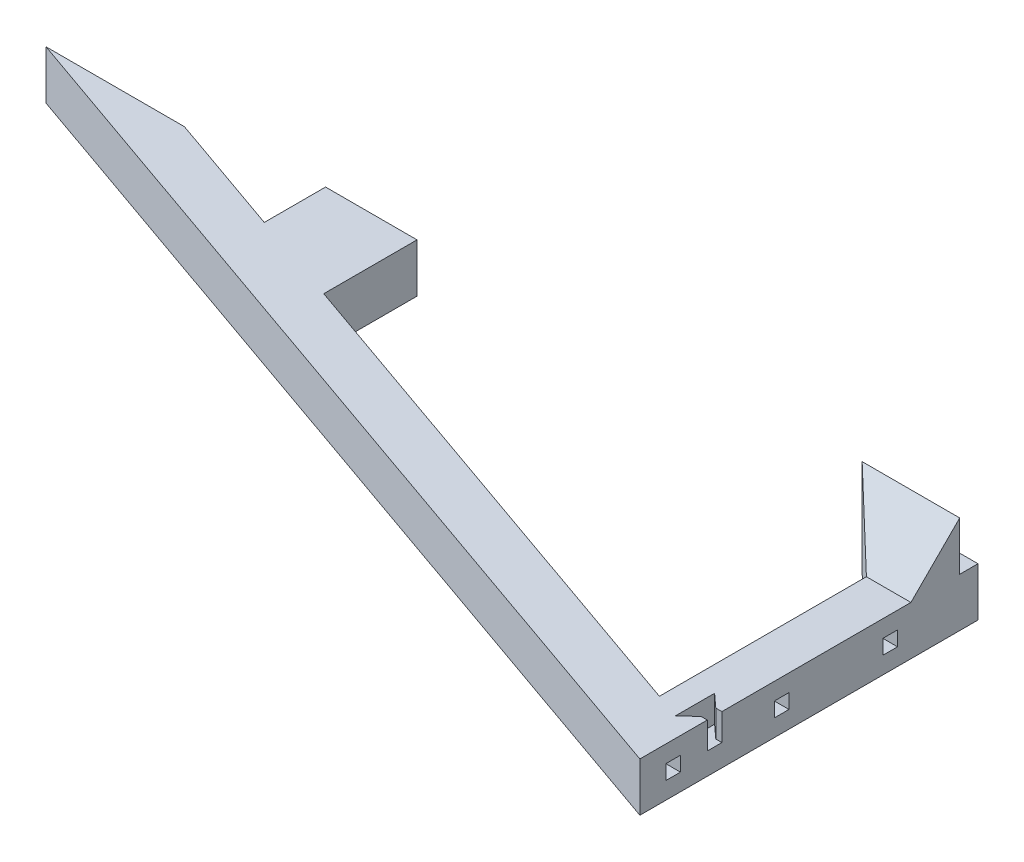
from build123d import *

# Parameters (mm, degrees)
P_IDAT_VYSUNUT_M1_DEPTH  = 8
ODEBRAT_VYSUNUT_M1_DEPTH = 4.4
P_IDAT_START             = 8
SKICA5_W                 = 16
SKICA5_H                 = 8
P_IDAT_VYSUNUT_M2_DEPTH  = 16
ODEBRAT_VYSUNUT_M3_DEPTH = 161.57934176
ODEBRAT_VYSUNUT_M4_DEPTH = 161.57934176
SKICA4_W                 = 2.4
SKICA4_H                 = 2.4
ODEBRAT_VYSUNUT_M2_DEPTH = 4.4


with BuildPart() as part:
    # Skica2 → Přidat vysunutím1 (new body)
    with BuildSketch(Plane(origin=(0, 0, 0), x_dir=(1, 0, 0), z_dir=(0, 1, 0))):
        Polygon((0, 0), (0, -55.45), (-149.85, -3), (-127.147799643, -3), (-107, -10.052066008), (-107, 0), (-92, 0), (-92, -15.302316258), (-7.3, -44.948729338), (-7.3, 0), align=None)
    extrude(amount=P_IDAT_VYSUNUT_M1_DEPTH)

    # Skica3 → Odebrat vysunutím1 (cut)
    with BuildSketch(Plane(origin=(0, 8, 0), x_dir=(1, 0, 0), z_dir=(0, 1, 0))):
        Polygon((0, -42), (-1, -42), (-3.2, -40), (-3.2, -46.4), (-1, -44.4), (0, -44.4), align=None)
    extrude(amount=-ODEBRAT_VYSUNUT_M1_DEPTH, mode=Mode.SUBTRACT)

    # Skica5 → Přidat vysunutím2 (add)
    with BuildSketch(Plane(origin=(0, 8, 0), x_dir=(1, 0, 0), z_dir=(0, 1, 0)).offset(P_IDAT_START)):
        with Locations((-8, -7)):
            Rectangle(SKICA5_W, SKICA5_H)
    extrude(amount=-P_IDAT_VYSUNUT_M2_DEPTH)

    # Skica6 → Odebrat vysunutím3 (cut, through all)
    with BuildSketch(Plane(origin=(0, 0, 0), x_dir=(0, 0, -1), z_dir=(1, 0, 0))):
        Polygon((-11, 8), (-11, 16), (-3, 16), align=None)
    extrude(amount=-ODEBRAT_VYSUNUT_M3_DEPTH, mode=Mode.SUBTRACT)

    # Skica7 → Odebrat vysunutím4 (cut, through all)
    with BuildSketch(Plane.XZ):
        Polygon((-16, 3), (-16, 11), (-7.3, 11), align=None)
    extrude(amount=-ODEBRAT_VYSUNUT_M4_DEPTH, mode=Mode.SUBTRACT)

    # Skica4 → Odebrat vysunutím2 (cut)
    with BuildSketch(Plane(origin=(0, 0, 0), x_dir=(0, 0, -1), z_dir=(1, 0, 0))):
        with Locations((-50, 4)):
            Rectangle(SKICA4_W, SKICA4_H)
        with Locations((-32.2, 4)):
            Rectangle(SKICA4_W, SKICA4_H)
        with Locations((-14.4, 4)):
            Rectangle(SKICA4_W, SKICA4_H)
    extrude(amount=-ODEBRAT_VYSUNUT_M2_DEPTH, mode=Mode.SUBTRACT)


solid = part.part
